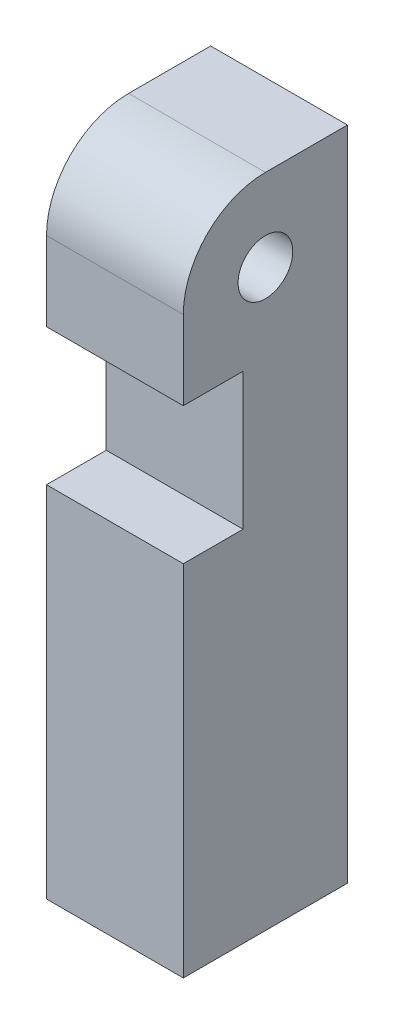
from build123d import *

# Parameters (mm, degrees)
ELEVATOR_PADDLE_R   = 1.27
BOSS_EXTRUDE1_DEPTH = 6.35


with BuildPart() as part:
    # Elevator Paddle → Boss-Extrude1 (new body)
    with BuildSketch(Plane(origin=(0, 0, 0), x_dir=(0, 0, -1), z_dir=(1, 0, 0))):
        with BuildLine():
            Line((3.81, -26.67), (3.81, 3.81))
            Line((3.81, 3.81), (0, 3.81))
            ThreePointArc((0, 3.81), (-2.694076836, 2.694076836), (-3.81, 0))
            Line((-3.81, 0), (-3.81, -3.6660188))
            Line((-3.81, -3.6660188), (-1.037499957, -3.6660188))
            Line((-1.037499957, -3.6660188), (-1.037499957, -10.0160188))
            Line((-1.037499957, -10.0160188), (-3.81, -10.0160188))
            Line((-3.81, -10.0160188), (-3.81, -26.67))
            Line((-3.81, -26.67), (3.81, -26.67))
        make_face()
        Circle(ELEVATOR_PADDLE_R, mode=Mode.SUBTRACT)
    extrude(amount=BOSS_EXTRUDE1_DEPTH)


solid = part.part
